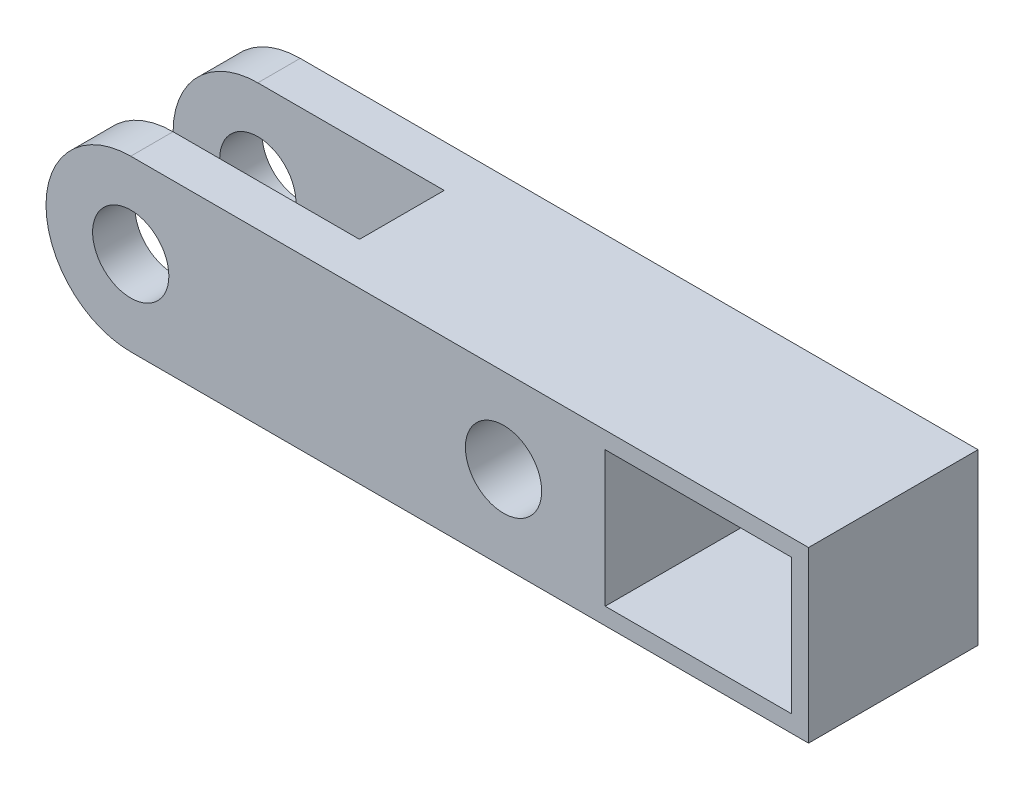
from build123d import *

# Parameters (mm, degrees)
SKETCH1_R           = 2.25
BOSS_EXTRUDE1_DEPTH = 5
SKETCH2_R           = 2.25
CUT_EXTRUDE2_DEPTH  = 43.426406871
SKETCH4_W           = 11
SKETCH4_H           = 8
CUT_EXTRUDE5_DEPTH  = 42.533119315
SKETCH5_W           = 16
SKETCH5_H           = 5
CUT_EXTRUDE6_DEPTH  = 42.533119315


with BuildPart() as part:
    # Sketch1 → Boss-Extrude1 (new, symmetric)
    with BuildSketch(Plane.XY):
        with BuildLine():
            Line((0, 5), (40, 5))
            Line((40, 5), (40, -5))
            Line((40, -5), (0, -5))
            ThreePointArc((0, -5), (-5, 0), (0, 5))
        make_face()
        Circle(SKETCH1_R, mode=Mode.SUBTRACT)
    extrude(amount=BOSS_EXTRUDE1_DEPTH, both=True)

    # Sketch2 → Cut-Extrude2 (cut, through all)
    with BuildSketch(Plane(origin=(0, -5, 5), x_dir=(1, 0, 0), z_dir=(0, 0, -1))):
        with Locations((22, -5)):
            Circle(SKETCH2_R)
    extrude(amount=CUT_EXTRUDE2_DEPTH, mode=Mode.SUBTRACT)

    # Sketch4 → Cut-Extrude5 (cut, through all)
    with BuildSketch(Plane(origin=(0, 0, 5), x_dir=(-1, 0, 0), z_dir=(0, 0, -1))):
        with Locations((-33.5, 0)):
            Rectangle(SKETCH4_W, SKETCH4_H)
    extrude(amount=CUT_EXTRUDE5_DEPTH, mode=Mode.SUBTRACT)

    # Sketch5 → Cut-Extrude6 (cut, through all)
    with BuildSketch(Plane.XZ.offset(5)):
        with Locations((3, 0)):
            Rectangle(SKETCH5_W, SKETCH5_H)
    extrude(amount=-CUT_EXTRUDE6_DEPTH, mode=Mode.SUBTRACT)


solid = part.part
